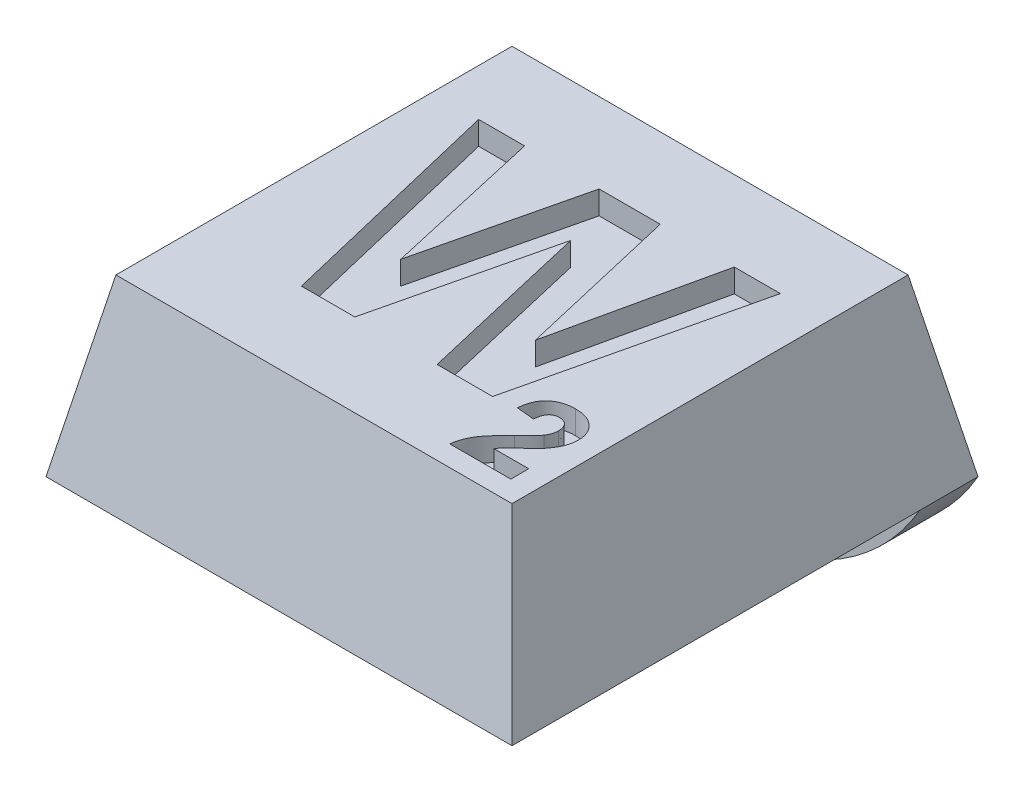
from build123d import *

# Parameters (mm, degrees)
SKETCH1_W               = 8
SKETCH1_H               = 8
BOSS_EXTRUDE1_DEPTH     = 3
CUT_EXTRUDE1_DEPTH      = 12.704699911
CUT_EXTRUDE1_DEPTH_BACK = 12.704699911
CUT_EXTRUDE2_DEPTH      = 11
SKETCH4_R               = 1.8
CUT_EXTRUDE3_DEPTH      = 0.8
SKETCH5_W               = 8
SKETCH5_H               = 1
BOSS_EXTRUDE2_DEPTH     = 2
FILLET1_R               = 4
CUT_EXTRUDE4_DEPTH      = 0.4
CUT_EXTRUDE5_DEPTH      = 0.4


with BuildPart() as part:
    # Sketch1 → Boss-Extrude1 (new body)
    with BuildSketch(Plane(origin=(0, 0, 0), x_dir=(1, 0, 0), z_dir=(0, 1, 0))):
        with Locations((4, 4)):
            Rectangle(SKETCH1_W, SKETCH1_H)
    extrude(amount=BOSS_EXTRUDE1_DEPTH)

    # Sketch2 → Cut-Extrude1 (cut, two sides: drawn at the far end of the back side and taken through both)
    with BuildSketch(Plane.XY.offset(-CUT_EXTRUDE1_DEPTH_BACK)):
        Polygon((0, 0), (0.6, 3), (0, 3), align=None)
        Polygon((8, 0), (7.4, 3), (8, 3), align=None)
    extrude(amount=CUT_EXTRUDE1_DEPTH + CUT_EXTRUDE1_DEPTH_BACK, mode=Mode.SUBTRACT)

    # Sketch3 → Cut-Extrude2 (cut)
    with BuildSketch(Plane(origin=(0, 0, 0), x_dir=(0, 0, -1), z_dir=(1, 0, 0))):
        Polygon((0, 0), (0.6, 3), (0, 3), align=None)
        Polygon((8, 3), (7.4, 3), (8, 0), align=None)
    extrude(amount=CUT_EXTRUDE2_DEPTH, mode=Mode.SUBTRACT)

    # Sketch4 → Cut-Extrude3 (cut)
    with BuildSketch(Plane.XZ):
        with Locations(Location((4, -3.75, 0), (0, 0, 270))):
            Circle(SKETCH4_R)
    extrude(amount=-CUT_EXTRUDE3_DEPTH, mode=Mode.SUBTRACT)

    # Sketch5 → Boss-Extrude2 (add)
    with BuildSketch(Plane.XZ):
        with Locations((4, -7.5)):
            Rectangle(SKETCH5_W, SKETCH5_H)
    extrude(amount=BOSS_EXTRUDE2_DEPTH)

    # Fillet1
    # the kernel refuses this fillet: 4 mm, written as the material it takes off along each edge
    with BuildSketch(Plane(origin=(8, -2, -16.660254038), x_dir=(0, 1, 0), z_dir=(0, 0, 1)), Plane(origin=(0, -2, 1.660254038), x_dir=(0, 1, 0), z_dir=(0, 0, -1))) as fillet1_piece_1:
        with BuildLine():
            CenterArc((4, 3.464101615), FILLET1_R, 180, 60)
            Line((0, 3.464101615), (-0.08, 3.464101615))
            Line((-0.08, 3.464101615), (-0.08, 0))
            Line((-0.08, 0), (0, -0.08))
            ThreePointArc((0, -0.08), (1, -0.08), (1.96, -0.069282032))
            Line((1.96, -0.069282032), (2, 0))
        make_face()
    extrude(amount=18.320508076, mode=Mode.SUBTRACT)

    # Sketch6 → Cut-Extrude4 (cut)
    with BuildSketch(Plane(origin=(0, 3, 0), x_dir=(1, 0, 0), z_dir=(0, 1, 0))):
        Polygon((2.358967796, 2.025988971), (1.401435745, 6.025988971), (2.189897284, 6.025988971), (2.811692155, 3.278392817), (3.469544719, 6.025988971), (4.519224207, 6.025988971), (5.170666514, 3.231918458), (5.790858822, 6.025988971), (6.580922925, 6.025988971), (5.641019078, 2.025988971), (4.688294719, 2.025988971), (3.991179335, 5.016373586), (3.275634463, 2.025988971), align=None)
    extrude(amount=-CUT_EXTRUDE4_DEPTH, mode=Mode.SUBTRACT)

    # Sketch7 → Cut-Extrude5 (cut)
    with BuildSketch(Plane(origin=(0, 3, 0), x_dir=(1, 0, 0), z_dir=(0, 1, 0))):
        with BuildLine():
            Line((7.025079926, 1.261869909), (7.025079926, 0.954177602))
            Line((7.025079926, 0.954177602), (5.978926079, 0.954177602))
            add(Edge.make_bspline(
                [(5.978926079, 0.954177602), (5.982468114, 0.980474374), (5.989550197, 1.033053173), (6.011445466, 1.109857564), (6.040668149, 1.184805528), (6.072383822, 1.245794978), (6.103928572, 1.294889387), (6.132549124, 1.335117725), (6.166692393, 1.37791895), (6.205862922, 1.423638586), (6.249844239, 1.472419552), (6.298964472, 1.524080492), (6.353457933, 1.578374089), (6.391795053, 1.615242112), (6.411618387, 1.634305807)],
                knots=[0, 0, 0, 0, 1.156289446, 2.311930546, 3.473459201, 4.661751613, 5.303057008, 6.018253237, 6.81459331, 7.690699809, 8.644447906, 9.679642995, 10.800191253, 12, 12, 12, 12], degree=3))
            add(Edge.make_bspline(
                [(6.411618387, 1.634305807), (6.427437635, 1.649575712), (6.457552822, 1.678645113), (6.500436909, 1.720271317), (6.538136439, 1.758537631), (6.571439659, 1.79245241), (6.599577217, 1.822879209), (6.622919237, 1.849340182), (6.641761343, 1.871943086), (6.651966244, 1.886282382), (6.656490182, 1.89263914)],
                knots=[0, 0, 0, 0, 1.480720495, 2.818855715, 4.024636094, 5.098235712, 6.019786162, 6.815086302, 7.474715479, 8, 8, 8, 8], degree=3))
            add(Edge.make_bspline(
                [(6.656490182, 1.89263914), (6.665754103, 1.908027503), (6.683623134, 1.937709873), (6.703218009, 1.984385935), (6.714979583, 2.031052356), (6.71659359, 2.062234592), (6.717387618, 2.077575038)],
                knots=[0, 0, 0, 0, 1.0911822, 2.104764037, 3.067617678, 4, 4, 4, 4], degree=3))
            add(Edge.make_bspline(
                [(6.717387618, 2.077575038), (6.716811351, 2.093538834), (6.7157211, 2.123741092), (6.706579153, 2.166362064), (6.690367393, 2.203000826), (6.668046783, 2.233769843), (6.639822327, 2.257877251), (6.606827118, 2.275690284), (6.568578157, 2.285538571), (6.541694532, 2.286833928), (6.527644028, 2.287510935)],
                knots=[0, 0, 0, 0, 1.193122327, 2.257294386, 3.237245624, 4.168877528, 5.075331632, 5.990371598, 6.949684428, 8, 8, 8, 8], degree=3))
            add(Edge.make_bspline(
                [(6.527644028, 2.287510935), (6.513688449, 2.286878661), (6.486729282, 2.285657243), (6.448414457, 2.274987105), (6.414896057, 2.256515974), (6.391009062, 2.235466338), (6.374872264, 2.214997095), (6.363877213, 2.197159499), (6.354400337, 2.17689052), (6.346003035, 2.154418352), (6.339370115, 2.129485554), (6.334028373, 2.102282013), (6.329723702, 2.072661336), (6.328354741, 2.052055079), (6.327644028, 2.041357089)],
                knots=[0, 0, 0, 0, 1.402788338, 2.709884207, 3.961032948, 5.225417836, 5.883680772, 6.578928686, 7.329201998, 8.132101139, 8.990263233, 9.922304639, 10.921339128, 12, 12, 12, 12], degree=3))
            Line((6.327644028, 2.041357089), (6.01995172, 2.071485294))
            add(Edge.make_bspline(
                [(6.01995172, 2.071485294), (6.022425519, 2.092258403), (6.027221819, 2.132534142), (6.039191066, 2.190383991), (6.054349674, 2.243753088), (6.073420305, 2.292542389), (6.095614746, 2.337062147), (6.122065099, 2.376644317), (6.15184716, 2.411727355), (6.184986668, 2.44229259), (6.221272944, 2.468437258), (6.259348879, 2.491775386), (6.299958585, 2.510920071), (6.342654946, 2.526698167), (6.387418668, 2.539307895), (6.434456788, 2.547645276), (6.483479006, 2.553509822), (6.516941776, 2.553951654), (6.534054285, 2.554177602)],
                knots=[0, 0, 0, 0, 1.270971563, 2.464210789, 3.586263665, 4.638946707, 5.643716971, 6.603612468, 7.52484387, 8.434700188, 9.336036235, 10.239171475, 11.145359471, 12.059630629, 13.003312604, 13.96741569, 14.960557767, 16, 16, 16, 16], degree=3))
            add(Edge.make_bspline(
                [(6.534054285, 2.554177602), (6.552657792, 2.553820052), (6.58889046, 2.553123679), (6.641783721, 2.547373025), (6.69147314, 2.537345926), (6.738393137, 2.524063615), (6.782061867, 2.506330758), (6.82284322, 2.484892472), (6.860095371, 2.458935129), (6.894373612, 2.429874295), (6.925015616, 2.397916799), (6.95185524, 2.363828728), (6.974341388, 2.327633829), (6.993210719, 2.289773279), (7.007221071, 2.249637846), (7.017429622, 2.207782494), (7.024198302, 2.164011958), (7.024782801, 2.134117674), (7.025079926, 2.118921192)],
                knots=[0, 0, 0, 0, 1.210756838, 2.35810096, 3.457354827, 4.507168606, 5.527358126, 6.519769748, 7.499700793, 8.476517721, 9.440526811, 10.376769937, 11.295256217, 12.209626307, 13.124630862, 14.055668209, 15.011616881, 16, 16, 16, 16], degree=3))
            add(Edge.make_bspline(
                [(7.025079926, 2.118921192), (7.024688468, 2.101480457), (7.023911876, 2.066880717), (7.016476584, 2.015731964), (7.005116907, 1.965762694), (6.988328197, 1.916850789), (6.967047205, 1.867822963), (6.939615495, 1.818569171), (6.907765206, 1.767604004), (6.882827684, 1.7346528), (6.86995172, 1.71763914)],
                knots=[0, 0, 0, 0, 0.953409949, 1.89141903, 2.821310783, 3.752688675, 4.715703262, 5.740811754, 6.833515735, 8, 8, 8, 8], degree=3))
            add(Edge.make_bspline(
                [(6.86995172, 1.71763914), (6.865085171, 1.711509707), (6.854662151, 1.698381883), (6.836929855, 1.678252394), (6.816379649, 1.656264646), (6.793301796, 1.632007081), (6.766933989, 1.606338723), (6.738224942, 1.578186143), (6.705911376, 1.548989439), (6.672442351, 1.518020294), (6.638827847, 1.487878461), (6.607931272, 1.459250402), (6.579866901, 1.433920718), (6.555941744, 1.410491095), (6.534748531, 1.390560588), (6.517051134, 1.373107183), (6.502518393, 1.358553413), (6.482493212, 1.335867777), (6.457013442, 1.305185447), (6.439087381, 1.275867612), (6.430528644, 1.261869909)],
                knots=[0, 0, 0, 0, 0.665555651, 1.425465941, 2.280616993, 3.225313414, 4.272635571, 5.410053715, 6.644756443, 7.976022804, 9.288331007, 10.484517221, 11.558462543, 12.503158964, 13.33222979, 14.032602617, 14.617328242, 15.080653724, 16.606167857, 18, 18, 18, 18], degree=3))
            Line((6.430528644, 1.261869909), (7.025079926, 1.261869909))
        make_face()
    extrude(amount=-CUT_EXTRUDE5_DEPTH, mode=Mode.SUBTRACT)


solid = part.part
